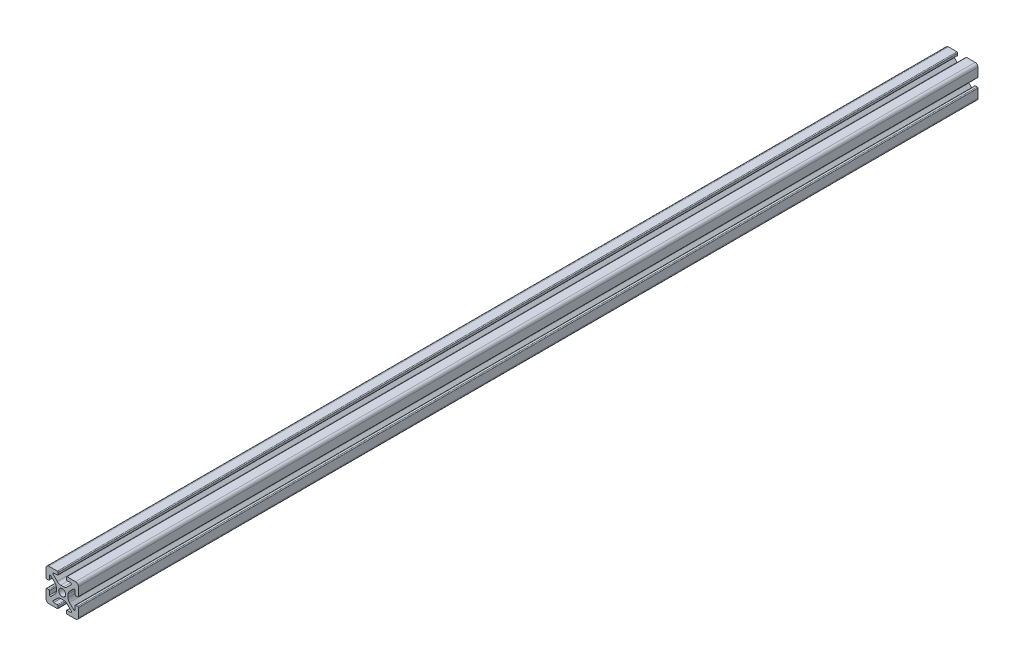
from build123d import *

# Parameters (mm, degrees)
BOSS_EXTRUDE1_DEPTH = 277.5


with BuildPart() as part:
    # Sketch4 → Boss-Extrude1 (new, symmetric)
    with BuildSketch(Plane.XY):
        with BuildLine():
            Line((3, -10), (8.25, -10))
            ThreePointArc((8.25, -10), (9.487436867, -9.487436867), (10, -8.25))
            Line((10, -8.25), (10, -3))
            ThreePointArc((10, -3), (9.853553391, -2.646446609), (9.5, -2.5))
            Line((9.5, -2.5), (8.424621202, -2.5))
            ThreePointArc((8.424621202, -2.5), (8.071067812, -2.646446609), (7.924621202, -3))
            Line((7.924621202, -3), (7.924621202, -5.25))
            ThreePointArc((7.924621202, -5.25), (7.615962919, -5.711939766), (7.071067812, -5.603553391))
            Line((7.071067812, -5.603553391), (4.478679656, -3.011165235))
            ThreePointArc((4.478679656, -3.011165235), (3.828361402, -2.037895189), (3.6, -0.889844892))
            Line((3.6, -0.889844892), (3.6, 0))
            Line((3.6, 0), (2.15, 0))
            ThreePointArc((2.15, 0), (1.52027958, -1.52027958), (0, -2.15))
            Line((0, -2.15), (0, -3.6))
            Line((0, -3.6), (0.889844892, -3.6))
            ThreePointArc((0.889844892, -3.6), (2.037895189, -3.828361402), (3.011165235, -4.478679656))
            Line((3.011165235, -4.478679656), (5.603553391, -7.071067812))
            ThreePointArc((5.603553391, -7.071067812), (5.711939766, -7.615962919), (5.25, -7.924621202))
            Line((5.25, -7.924621202), (3, -7.924621202))
            ThreePointArc((3, -7.924621202), (2.646446609, -8.071067812), (2.5, -8.424621202))
            Line((2.5, -8.424621202), (2.5, -9.5))
            ThreePointArc((2.5, -9.5), (2.646446609, -9.853553391), (3, -10))
        make_face()
    extrude(amount=BOSS_EXTRUDE1_DEPTH, both=True)

    # Mirror1: part across plane


with BuildPart() as part_1:
    add(part.part)
    add(part.part.mirror(Plane(origin=(0, 0, 0), x_dir=(0, 0, 1), z_dir=(1, 0, 0))))

    # Mirror2: part across plane


with BuildPart() as part_2:
    add(part_1.part)
    add(part_1.part.mirror(Plane.ZX))


solid = part_2.part
